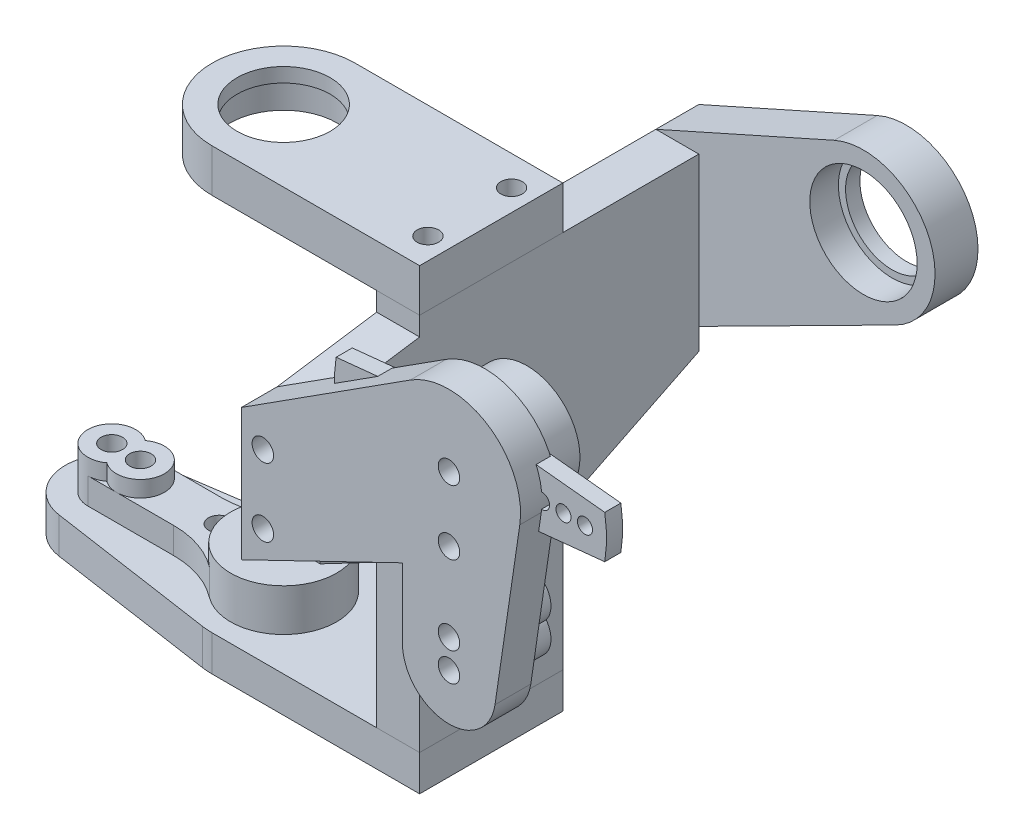
from build123d import *

# Parameters (mm, degrees)
SKETCH2_R                                = 10
BOSS_EXTRUDE1_DEPTH                      = 5
SKETCH3_R                                = 10
BOSS_EXTRUDE2_DEPTH                      = 6
SKETCH4_R                                = 7.5
CUT_EXTRUDE1_DEPTH                       = 4
SKETCH5_R                                = 6.5
CUT_EXTRUDE2_DEPTH                       = 4
MG995_START                              = -0.991050259
MG995_SERVO_HORN_TWO_PRONG_OUTLINE_R     = 1.05
MG995_SERVO_HORN_TWO_PRONG_OUTLINE_R_2   = 3.5
MG995_SERVO_HORN_TWO_PRONG_DEPTH         = 2.25
MG995_START_2                            = -4.191050259
MG995_SERVO_HORN_TWO_PRONG_2_OUTLINE_R   = 4.375
MG995_SERVO_HORN_TWO_PRONG_2_OUTLINE_R_2 = 2.925
MG995_SERVO_HORN_TWO_PRONG_2_DEPTH       = 4.45
MG995_START_3                            = -1.391050259
MG995_SERVO_HORN_TWO_PRONG_3_OUTLINE_R   = 2.925
MG995_SERVO_HORN_TWO_PRONG_3_OUTLINE_R_2 = 1.5
MG995_SERVO_HORN_TWO_PRONG_3_DEPTH       = 1.65
CUT_EXTRUDE3_DEPTH                       = 66.200930898
CUT_EXTRUDE3_DEPTH_BACK                  = 66.200930898
SKETCH6_W                                = 0.691032415
SKETCH6_H                                = 0.410386563
BODY_MOVE_COPY1_ANGLE                    = 180
SKETCH43_W                               = 20
SKETCH43_H                               = 52.9
BOSS_EXTRUDE19_DEPTH                     = 6
BOSS_EXTRUDE20_DEPTH                     = 6
BOSS_EXTRUDE21_START                     = -5
BOSS_EXTRUDE21_DEPTH                     = 5
CUT_EXTRUDE23_DEPTH                      = 71.881661944
CUT_EXTRUDE23_DEPTH_BACK                 = 71.881661944
SKETCH47_R                               = 1.5
SKETCH48_R                               = 10
BOSS_EXTRUDE22_DEPTH                     = 6
SKETCH49_R                               = 7.5
CUT_EXTRUDE24_DEPTH                      = 4
CUT_EXTRUDE25_DEPTH                      = 96.168272024
CUT_EXTRUDE25_DEPTH_BACK                 = 96.168272024
SKETCH50_R                               = 6.5
SKETCH51_R                               = 10
BOSS_EXTRUDE23_DEPTH                     = 5
BODY_MOVE_COPY2_ANGLE                    = 90
BOSS_EXTRUDE24_DEPTH                     = 5
CUT_EXTRUDE27_DEPTH                      = 112.750659952
CUT_EXTRUDE27_DEPTH_BACK                 = 112.750659952
SKETCH53_R                               = 1.5
CUT_EXTRUDE30_DEPTH                      = 106.603077605
CUT_EXTRUDE30_DEPTH_BACK                 = 106.603077605
SKETCH56_R                               = 1.5
BOSS_EXTRUDE25_DEPTH                     = 6
BOSS_EXTRUDE26_DEPTH                     = 6
CUT_EXTRUDE31_DEPTH                      = 112.750659952
CUT_EXTRUDE31_DEPTH_BACK                 = 112.750659952
SKETCH60_R                               = 1.5
HORN_START                               = 68.290663571
HORN_25T_METAL_OUTLINE_R                 = 7.4
HORN_25T_METAL_OUTLINE_R_2               = 2.75
HORN_25T_METAL_OUTLINE_R_3               = 1.5
HORN_25T_METAL_DEPTH                     = 5.9
HORN_START_2                             = 70.690663571
HORN_25T_METAL_2_OUTLINE_R               = 1.5
HORN_25T_METAL_2_OUTLINE_R_2             = 2.75
HORN_25T_METAL_2_DEPTH                   = 3.5
HORN_START_3                             = 70.540663571
HORN_25T_METAL_3_OUTLINE_R               = 1.5
HORN_25T_METAL_3_DEPTH                   = 0.15
BODY_MOVE_COPY3_ANGLE                    = 180
BOSS_EXTRUDE27_DEPTH                     = 5
CUT_EXTRUDE35_DEPTH                      = 112.750659952
CUT_EXTRUDE35_DEPTH_BACK                 = 112.750659952
SKETCH66_R                               = 1.5
HORN_25T_METAL2_ANGLE                    = 180
BODY_MOVE_COPY4_ANGLE                    = 120
BOSS_EXTRUDE28_START                     = -5
BOSS_EXTRUDE28_DEPTH                     = 5
CUT_EXTRUDE36_DEPTH                      = 106.603077605
CUT_EXTRUDE36_DEPTH_BACK                 = 5
SKETCH68_R                               = 1.5


with BuildPart() as part:
    # Sketch2 → Boss-Extrude1 (new body)
    with BuildSketch(Plane(origin=(0, -6.9, 0), x_dir=(1, 0, 0), z_dir=(0, 1, 0))):
        with Locations(Location((0, 0, 0), (0, 0, 270))):
            Circle(SKETCH2_R)
    extrude(amount=-BOSS_EXTRUDE1_DEPTH)

    # Sketch45 → Boss-Extrude21 (add)
    with BuildSketch(Plane.XZ.offset(11.9).offset(BOSS_EXTRUDE21_START)):
        with BuildLine():
            Line((0, 10), (29, 10))
            Line((29, 10), (29, -10))
            Line((29, -10), (0, -10))
            ThreePointArc((0, -10), (10, 0), (0, 10))
        make_face()
    extrude(amount=BOSS_EXTRUDE21_DEPTH)


with BuildPart() as body_2:
    # Sketch3 → Boss-Extrude2 (new body)
    with BuildSketch(Plane(origin=(0, 46, 0), x_dir=(1, 0, 0), z_dir=(0, 1, 0))):
        with Locations(Location((0, 0, 0), (0, 0, 270))):
            Circle(SKETCH3_R)
    extrude(amount=BOSS_EXTRUDE2_DEPTH)

    # Sketch4 → Cut-Extrude1 (cut)
    with BuildSketch(Plane.XZ.offset(-46)):
        with Locations(Location((0, 0, 0), (0, 0, 270))):
            Circle(SKETCH4_R)
    extrude(amount=-CUT_EXTRUDE1_DEPTH, mode=Mode.SUBTRACT)

    # Sketch5 → Cut-Extrude2 (cut)
    with BuildSketch(Plane.XZ.offset(-50)):
        with Locations(Location((0, 0, 0), (0, 0, 270))):
            Circle(SKETCH5_R)
    extrude(amount=-CUT_EXTRUDE2_DEPTH, mode=Mode.SUBTRACT)

    # Sketch44 → Boss-Extrude20 (add)
    with BuildSketch(Plane(origin=(0, 52, 0), x_dir=(1, 0, 0), z_dir=(0, 1, 0))):
        with BuildLine():
            Line((29, 10), (0, 10))
            ThreePointArc((0, 10), (10, 0), (0, -10))
            Line((0, -10), (29, -10))
            Line((29, -10), (29, 10))
        make_face()
    extrude(amount=-BOSS_EXTRUDE20_DEPTH)


with BuildPart() as body_3:
    # MG995- SERVO HORN TWO PRONG: read off the stored shape, not the designer's step
    # MG995- SERVO HORN TWO PRONG outline → MG995- SERVO HORN TWO PRONG (new body)
    with BuildSketch(Plane(origin=(0, 0, 0), x_dir=(1, 0, 0), z_dir=(0, 1, 0)).offset(MG995_START)):
        with BuildLine():
            ThreePointArc((-5.001086692, 19.366332961), (-5.237928798, 16.375696604), (-5.001086692, 13.385060248))
            Line((-5.001086692, 13.385060248), (9.793444236, 11.875696605))
            ThreePointArc((9.793444236, 11.875696605), (13.762071202, 10.375696605), (17.730698169, 11.875696605))
            Line((17.730698169, 11.875696605), (32.525229097, 13.385060248))
            ThreePointArc((32.525229097, 13.385060248), (32.762071202, 16.375696604), (32.525229097, 19.366332961))
            Line((32.525229097, 19.366332961), (17.730698169, 20.875696605))
            ThreePointArc((17.730698169, 20.875696605), (13.762071202, 22.375696605), (9.793444236, 20.875696605))
            Line((9.793444236, 20.875696605), (-5.001086692, 19.366332961))
        make_face()
        with Locations((-2.237928798, 16.375696605)):
            Circle(MG995_SERVO_HORN_TWO_PRONG_OUTLINE_R, mode=Mode.SUBTRACT)
        with Locations((0.762071202, 16.375696605)):
            Circle(MG995_SERVO_HORN_TWO_PRONG_OUTLINE_R, mode=Mode.SUBTRACT)
        with Locations((3.762071202, 16.375696605)):
            Circle(MG995_SERVO_HORN_TWO_PRONG_OUTLINE_R, mode=Mode.SUBTRACT)
        with Locations((6.762071202, 16.375696605)):
            Circle(MG995_SERVO_HORN_TWO_PRONG_OUTLINE_R, mode=Mode.SUBTRACT)
        with Locations((20.762071202, 16.375696605)):
            Circle(MG995_SERVO_HORN_TWO_PRONG_OUTLINE_R, mode=Mode.SUBTRACT)
        with Locations((23.762071202, 16.375696605)):
            Circle(MG995_SERVO_HORN_TWO_PRONG_OUTLINE_R, mode=Mode.SUBTRACT)
        with Locations((26.762071202, 16.375696605)):
            Circle(MG995_SERVO_HORN_TWO_PRONG_OUTLINE_R, mode=Mode.SUBTRACT)
        with Locations((29.762071202, 16.375696605)):
            Circle(MG995_SERVO_HORN_TWO_PRONG_OUTLINE_R, mode=Mode.SUBTRACT)
        with Locations((13.762071202, 16.375696605)):
            Circle(MG995_SERVO_HORN_TWO_PRONG_OUTLINE_R_2, mode=Mode.SUBTRACT)
    extrude(amount=MG995_SERVO_HORN_TWO_PRONG_DEPTH)

    # MG995- SERVO HORN TWO PRONG 2 outline → MG995- SERVO HORN TWO PRONG 2 (add)
    with BuildSketch(Plane(origin=(0, 0, 0), x_dir=(1, 0, 0), z_dir=(0, 1, 0)).offset(MG995_START_2)):
        with Locations((13.762071202, 16.375696605)):
            Circle(MG995_SERVO_HORN_TWO_PRONG_2_OUTLINE_R)
        with Locations((13.762071202, 16.375696605)):
            Circle(MG995_SERVO_HORN_TWO_PRONG_2_OUTLINE_R_2, mode=Mode.SUBTRACT)
    extrude(amount=MG995_SERVO_HORN_TWO_PRONG_2_DEPTH)

    # MG995- SERVO HORN TWO PRONG 3 outline → MG995- SERVO HORN TWO PRONG 3 (add)
    with BuildSketch(Plane(origin=(0, 0, 0), x_dir=(1, 0, 0), z_dir=(0, 1, 0)).offset(MG995_START_3)):
        with Locations((13.762071202, 16.375696605)):
            Circle(MG995_SERVO_HORN_TWO_PRONG_3_OUTLINE_R)
        with Locations((13.762071202, 16.375696605)):
            Circle(MG995_SERVO_HORN_TWO_PRONG_3_OUTLINE_R_2, mode=Mode.SUBTRACT)
    extrude(amount=MG995_SERVO_HORN_TWO_PRONG_3_DEPTH)

    # Sketch6 → Cut-Extrude3 (cut, two sides: drawn at the far end of the back side and taken through both)
    with BuildSketch(Plane(origin=(0, 0.258949741, 0), x_dir=(1, 0, 0), z_dir=(0, 1, 0)).offset(-CUT_EXTRUDE3_DEPTH_BACK)):
        with Locations((13.762071202, 17.875696604)):
            Rectangle(SKETCH6_W, SKETCH6_H)
    extrude(amount=CUT_EXTRUDE3_DEPTH + CUT_EXTRUDE3_DEPTH_BACK, mode=Mode.SUBTRACT)


with BuildPart() as body_3_1:
    # Body-Move/Copy1: read off the stored shape, not the designer's step
    # Body-Move/Copy1: moved
    add(body_3.part.moved(Location((-13.7620712, 7.6410503, 16.3756966))).rotate(Axis((0, 0, 0), (0, 0, 1)), BODY_MOVE_COPY1_ANGLE))


with BuildPart() as body_4:
    # Sketch43 → Boss-Extrude19 (new body)
    with BuildSketch(Plane(origin=(23, 0, 0), x_dir=(0, 0, -1), z_dir=(1, 0, 0))):
        with Locations((0, 19.55)):
            Rectangle(SKETCH43_W, SKETCH43_H)
    extrude(amount=BOSS_EXTRUDE19_DEPTH)


with BuildPart() as cut_extrude23_tool:
    # Sketch47 → Cut-Extrude23 (new, two sides: drawn at the far end of the back side and taken through both)
    with BuildSketch(Plane(origin=(0, 52, 0), x_dir=(1, 0, 0), z_dir=(0, 1, 0)).offset(-CUT_EXTRUDE23_DEPTH_BACK)):
        with Locations(Location((26, -5.841574982, 0), (0, 0, 270))):
            Circle(SKETCH47_R)
        with Locations(Location((26, 5.841574982, 0), (0, 0, 270))):
            Circle(SKETCH47_R)
    extrude(amount=CUT_EXTRUDE23_DEPTH + CUT_EXTRUDE23_DEPTH_BACK)


with BuildPart() as part_1:
    add(part.part)

    # Cut-Extrude23: cut by cut_extrude23_tool
    add(cut_extrude23_tool.part, mode=Mode.SUBTRACT)

    # Sketch56 → Cut-Extrude30 (cut, two sides: drawn at the far end of the back side and taken through both)
    with BuildSketch(Plane.XZ.offset(11.9).offset(-CUT_EXTRUDE30_DEPTH_BACK)):
        with Locations(Location((0, 0, 0), (0, 0, 90))):
            Circle(SKETCH56_R)
    extrude(amount=CUT_EXTRUDE30_DEPTH + CUT_EXTRUDE30_DEPTH_BACK, mode=Mode.SUBTRACT)

    # Sketch67 → Boss-Extrude28 (add)
    with BuildSketch(Plane.XZ.offset(11.9).offset(BOSS_EXTRUDE28_START)):
        with BuildLine():
            Line((-24.947916667, 6.430509622), (-1.458333333, 9.893091725))
            ThreePointArc((-1.458333333, 9.893091725), (-10, 0), (-1.458333333, -9.893091725))
            Line((-1.458333333, -9.893091725), (-24.947916667, -6.430509622))
            ThreePointArc((-24.947916667, -6.430509622), (-30.5, 0), (-24.947916667, 6.430509622))
        make_face()
    extrude(amount=BOSS_EXTRUDE28_DEPTH)

    # Sketch68 → Cut-Extrude36 (cut, two sides: drawn at the far end of the back side and taken through both)
    with BuildSketch(Plane.XZ.offset(11.9).offset(-CUT_EXTRUDE36_DEPTH_BACK)):
        with Locations(Location((-20, 0, 0), (0, 0, 90))):
            Circle(SKETCH68_R)
        with Locations(Location((-24, 0, 0), (0, 0, 90))):
            Circle(SKETCH68_R)
        with Locations(Location((-9, 0, 0), (0, 0, 90))):
            Circle(SKETCH68_R)
    extrude(amount=CUT_EXTRUDE36_DEPTH + CUT_EXTRUDE36_DEPTH_BACK, mode=Mode.SUBTRACT)


with BuildPart() as body_2_1:
    add(body_2.part)

    # Cut-Extrude23: cut by cut_extrude23_tool
    add(cut_extrude23_tool.part, mode=Mode.SUBTRACT)


with BuildPart() as body_4_1:
    add(body_4.part)

    # Cut-Extrude23: cut by cut_extrude23_tool
    add(cut_extrude23_tool.part, mode=Mode.SUBTRACT)

    # Sketch59 → Boss-Extrude26 (add)
    with BuildSketch(Plane.ZY.offset(-23)):
        Polygon((23.9, 22.874419496), (10, 16.265643143), (10, 43.371679133), (23.9, 41.298034994), align=None)
        Polygon((-29, 46), (-10, 46), (-10, 12.71485245), (-29, 22.118074869), align=None)
    extrude(amount=-BOSS_EXTRUDE26_DEPTH)


with BuildPart() as body_5:
    # Sketch48 → Boss-Extrude22 (new body)
    with BuildSketch(Plane.XY.offset(-29)):
        with Locations((52, 48)):
            Circle(SKETCH48_R)
    extrude(amount=-BOSS_EXTRUDE22_DEPTH)

    # Sketch49 → Cut-Extrude24 (cut)
    with BuildSketch(Plane.XY.offset(-29)):
        with Locations((52, 48)):
            Circle(SKETCH49_R)
    extrude(amount=-CUT_EXTRUDE24_DEPTH, mode=Mode.SUBTRACT)

    # Sketch50 → Cut-Extrude25 (cut, two sides: drawn at the far end of the back side and taken through both)
    with BuildSketch(Plane.XY.offset(-33).offset(-CUT_EXTRUDE25_DEPTH_BACK)):
        with Locations((52, 48)):
            Circle(SKETCH50_R)
    extrude(amount=CUT_EXTRUDE25_DEPTH + CUT_EXTRUDE25_DEPTH_BACK, mode=Mode.SUBTRACT)

    # Sketch58 → Boss-Extrude25 (add)
    with BuildSketch(Plane(origin=(0, 0, -35), x_dir=(-1, 0, 0), z_dir=(0, 0, -1))):
        with BuildLine():
            Line((-47.922019216, 57.130721369), (-23, 46))
            Line((-23, 46), (-23, 22.118074869))
            Line((-23, 22.118074869), (-56.515046156, 39.077312165))
            ThreePointArc((-56.515046156, 39.077312165), (-42.970650493, 43.702227614), (-47.922019216, 57.130721369))
        make_face()
    extrude(amount=-BOSS_EXTRUDE25_DEPTH)


with BuildPart() as body_6:
    # Sketch51 → Boss-Extrude23 (new body)
    with BuildSketch(Plane.XY.offset(23.9)):
        with Locations((52, 48)):
            Circle(SKETCH51_R)
    extrude(amount=BOSS_EXTRUDE23_DEPTH)

    # Sketch57 → Boss-Extrude24 (add)
    with BuildSketch(Plane.XY.offset(28.9)):
        with BuildLine():
            Line((46.605763497, 56.420345156), (23, 41.298034994))
            Line((23, 41.298034994), (23, 22.874419496))
            Line((23, 22.874419496), (56.352148131, 38.996733557))
            ThreePointArc((56.352148131, 38.996733557), (43.27262655, 43.118099482), (46.605763497, 56.420345156))
        make_face()
    extrude(amount=-BOSS_EXTRUDE24_DEPTH)

    # Sketch53 → Cut-Extrude27 (cut, two sides: drawn at the far end of the back side and taken through both)
    with BuildSketch(Plane.XY.offset(28.9).offset(-CUT_EXTRUDE27_DEPTH_BACK)):
        with Locations((52, 48)):
            Circle(SKETCH53_R)
    extrude(amount=CUT_EXTRUDE27_DEPTH + CUT_EXTRUDE27_DEPTH_BACK, mode=Mode.SUBTRACT)


with BuildPart() as body_3_2:
    # Body-Move/Copy2: read off the stored shape, not the designer's step
    # Body-Move/Copy2: moved
    add(body_3_1.part.moved(Location((52, -17, 48))).rotate(Axis((0, 0, 0), (-1, 0, 0)), BODY_MOVE_COPY2_ANGLE))


with BuildPart() as cut_extrude31_tool:
    # Sketch60 → Cut-Extrude31 (new, two sides: drawn at the far end of the back side and taken through both)
    with BuildSketch(Plane.XY.offset(28.9).offset(-CUT_EXTRUDE31_DEPTH_BACK)):
        with Locations((26, 37.697644447)):
            Circle(SKETCH60_R)
        with Locations((26, 28.143433987)):
            Circle(SKETCH60_R)
    extrude(amount=CUT_EXTRUDE31_DEPTH + CUT_EXTRUDE31_DEPTH_BACK)


with BuildPart() as body_4_2:
    add(body_4_1.part)

    # Cut-Extrude31: cut by cut_extrude31_tool
    add(cut_extrude31_tool.part, mode=Mode.SUBTRACT)


with BuildPart() as body_5_1:
    add(body_5.part)

    # Cut-Extrude31: cut by cut_extrude31_tool
    add(cut_extrude31_tool.part, mode=Mode.SUBTRACT)


with BuildPart() as body_6_1:
    add(body_6.part)

    # Cut-Extrude31: cut by cut_extrude31_tool
    add(cut_extrude31_tool.part, mode=Mode.SUBTRACT)

    # Sketch65 → Boss-Extrude27 (add)
    with BuildSketch(Plane.XY.offset(28.9)):
        with BuildLine():
            Line((58.430509622, 23.052083333), (61.893091725, 46.541666667))
            ThreePointArc((61.893091725, 46.541666667), (60.059976337, 42.080812434), (56.352148131, 38.996733557))
            Line((56.352148131, 38.996733557), (45.5, 33.750842356))
            Line((45.5, 33.750842356), (45.5, 24))
            ThreePointArc((45.5, 24), (51.524769814, 17.517395873), (58.430509622, 23.052083333))
        make_face()
    extrude(amount=-BOSS_EXTRUDE27_DEPTH)

    # Sketch66 → Cut-Extrude35 (cut, two sides: drawn at the far end of the back side and taken through both)
    with BuildSketch(Plane.XY.offset(28.9).offset(-CUT_EXTRUDE35_DEPTH_BACK)):
        with Locations(Location((52, 24, 0), (0, 0, 180))):
            Circle(SKETCH66_R)
        with Locations(Location((52, 28, 0), (0, 0, 180))):
            Circle(SKETCH66_R)
        with Locations(Location((52, 39, 0), (0, 0, 180))):
            Circle(SKETCH66_R)
    extrude(amount=CUT_EXTRUDE35_DEPTH + CUT_EXTRUDE35_DEPTH_BACK, mode=Mode.SUBTRACT)


with BuildPart() as body_7:
    # HORN 25T METAL: read off the stored shape, not the designer's step
    # HORN 25T METAL outline → HORN 25T METAL (new body)
    # profile 1 of 2: a face of its own
    with BuildSketch(Plane.XY.offset(HORN_START)):
        with Locations((66.918439836, 24.281823444)):
            Circle(HORN_25T_METAL_OUTLINE_R)
        with Locations((66.918439836, 24.281823444)):
            Circle(HORN_25T_METAL_OUTLINE_R_2, mode=Mode.SUBTRACT)
    # profile 2 of 2: a face of its own
    with BuildSketch(Plane.XY.offset(HORN_START)):
        with BuildLine():
            ThreePointArc((64.230968906, 46.281823444), (66.918439836, 40.931823444), (69.605910766, 46.281823444))
            ThreePointArc((69.605910766, 46.281823444), (66.918439836, 51.631823444), (64.230968906, 46.281823444))
        make_face()
        with Locations((66.918439836, 44.281823444)):
            Circle(HORN_25T_METAL_OUTLINE_R_3, mode=Mode.SUBTRACT)
        with Locations((66.918439836, 48.281823444)):
            Circle(HORN_25T_METAL_OUTLINE_R_3, mode=Mode.SUBTRACT)
    extrude(amount=HORN_25T_METAL_DEPTH)

    # HORN 25T METAL 2 outline → HORN 25T METAL 2 (add)
    # profile 1 of 4: a face of its own
    with BuildSketch(Plane.XY.offset(HORN_START_2)):
        with BuildLine():
            Line((63.568439836, 44.281823444), (63.568439836, 36.281823444))
            ThreePointArc((63.568439836, 36.281823444), (62.91719824, 32.315679982), (61.031863878, 28.766042829))
            ThreePointArc((61.031863878, 28.766042829), (66.918439836, 31.681823444), (72.805015794, 28.766042829))
            ThreePointArc((72.805015794, 28.766042829), (70.919681431, 32.315679982), (70.268439836, 36.281823444))
            Line((70.268439836, 36.281823444), (70.268439836, 44.281823444))
            ThreePointArc((70.268439836, 44.281823444), (66.918439836, 40.931823444), (63.568439836, 44.281823444))
        make_face()
        with Locations((66.918439836, 33.281823444)):
            Circle(HORN_25T_METAL_2_OUTLINE_R, mode=Mode.SUBTRACT)
    # profile 2 of 4: a face of its own
    with BuildSketch(Plane.XY.offset(HORN_START_2)):
        with BuildLine():
            Line((63.568439836, 48.281823444), (63.568439836, 44.281823444))
            ThreePointArc((63.568439836, 44.281823444), (63.738382634, 45.335263614), (64.230968906, 46.281823444))
            ThreePointArc((64.230968906, 46.281823444), (63.738382634, 47.228383274), (63.568439836, 48.281823444))
        make_face()
    # profile 3 of 4: a face of its own
    with BuildSketch(Plane.XY.offset(HORN_START_2)):
        with BuildLine():
            ThreePointArc((69.605910766, 46.281823444), (70.098497038, 45.335263614), (70.268439836, 44.281823444))
            Line((70.268439836, 44.281823444), (70.268439836, 48.281823444))
            ThreePointArc((70.268439836, 48.281823444), (70.098497038, 47.228383274), (69.605910766, 46.281823444))
        make_face()
    # profile 4 of 4: a face of its own
    with BuildSketch(Plane.XY.offset(HORN_START_2)):
        with Locations((66.918439836, 24.281823444)):
            Circle(HORN_25T_METAL_2_OUTLINE_R_2)
        with Locations((66.918439836, 24.281823444)):
            Circle(HORN_25T_METAL_2_OUTLINE_R, mode=Mode.SUBTRACT)
    extrude(amount=HORN_25T_METAL_2_DEPTH)

    # HORN 25T METAL 3 outline → HORN 25T METAL 3 (add)
    # profile 1 of 3: a face of its own
    with BuildSketch(Plane.XY.offset(HORN_START_3)):
        with BuildLine():
            Line((63.568439836, 44.281823444), (63.568439836, 36.281823444))
            ThreePointArc((63.568439836, 36.281823444), (62.91719824, 32.315679982), (61.031863878, 28.766042829))
            ThreePointArc((61.031863878, 28.766042829), (66.918439836, 31.681823444), (72.805015794, 28.766042829))
            ThreePointArc((72.805015794, 28.766042829), (70.919681431, 32.315679982), (70.268439836, 36.281823444))
            Line((70.268439836, 36.281823444), (70.268439836, 44.281823444))
            ThreePointArc((70.268439836, 44.281823444), (66.918439836, 40.931823444), (63.568439836, 44.281823444))
        make_face()
        with Locations((66.918439836, 33.281823444)):
            Circle(HORN_25T_METAL_3_OUTLINE_R, mode=Mode.SUBTRACT)
    # profile 2 of 3: a face of its own
    with BuildSketch(Plane.XY.offset(HORN_START_3)):
        with BuildLine():
            Line((63.568439836, 48.281823444), (63.568439836, 44.281823444))
            ThreePointArc((63.568439836, 44.281823444), (63.738382634, 45.335263614), (64.230968906, 46.281823444))
            ThreePointArc((64.230968906, 46.281823444), (63.738382634, 47.228383274), (63.568439836, 48.281823444))
        make_face()
    # profile 3 of 3: a face of its own
    with BuildSketch(Plane.XY.offset(HORN_START_3)):
        with BuildLine():
            ThreePointArc((69.605910766, 46.281823444), (70.098497038, 45.335263614), (70.268439836, 44.281823444))
            Line((70.268439836, 44.281823444), (70.268439836, 48.281823444))
            ThreePointArc((70.268439836, 48.281823444), (70.098497038, 47.228383274), (69.605910766, 46.281823444))
        make_face()
    extrude(amount=HORN_25T_METAL_3_DEPTH)


with BuildPart() as body_7_1:
    # Body-Move/Copy3: read off the stored shape, not the designer's step
    # Body-Move/Copy3: moved
    add(body_7.part.moved(Location((-118.9184398, -72.2818234, -50.2906636))).rotate(Axis((0, 0, 0), (0, 0, 1)), BODY_MOVE_COPY3_ANGLE))


with BuildPart() as body_8:
    # HORN 25T METAL2: read off the stored shape, not the designer's step
    # HORN 25T METAL2: copy of body 7
    add(body_7_1.part.moved(Location((5.5299496, -72.963796, -25.8626172))).rotate(Axis((0, 0, 0), (0, 0, 1)), HORN_25T_METAL2_ANGLE))


with BuildPart() as body_8_1:
    # Body-Move/Copy4: read off the stored shape, not the designer's step
    # Body-Move/Copy4: moved
    add(body_8.part.moved(Location((57.5299496, -24.963796, 8.8626172))).rotate(Axis((0, 0, 0), (0.5773502692, -0.5773502692, 0.5773502692)), BODY_MOVE_COPY4_ANGLE))


solid = Compound([part_1.part, body_2_1.part, body_3_2.part, body_4_2.part, body_5_1.part, body_6_1.part, body_7_1.part, body_8_1.part])
